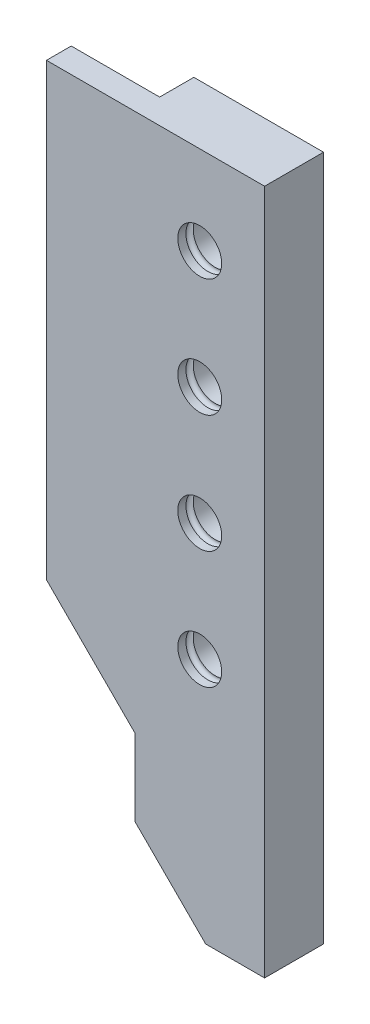
from build123d import *

# Parameters (mm, degrees)
BOSS_EXTRUDE1_DEPTH = 4.2
BOSS_EXTRUDE2_DEPTH = 5.8
CUT_EXTRUDE1_REACH  = 107.801
SKETCH2_R           = 3.725
SKETCH3_R           = 0.65
LPATTERN1_COUNT     = 4
LPATTERN1_PITCH     = 20
CUT_EXTRUDE2_REACH  = 107.801


with BuildPart() as part:
    # Sketch1 → Boss-Extrude1 (new body)
    with BuildSketch(Plane.XY):
        Polygon((25.2, 31.320919527), (25.2, -45), (40.2, -60), (40.2, -85), (62.2, -85), (62.2, 31.320919527), align=None)
    extrude(amount=BOSS_EXTRUDE1_DEPTH)

    # Sketch1<3> → Boss-Extrude2 (add)
    with BuildSketch(Plane.XY):
        Polygon((62.2, 31.320919527), (40.2, 31.320919527), (40.2, -60), (40.2, -85), (62.2, -85), align=None)
    extrude(amount=-BOSS_EXTRUDE2_DEPTH)

    # Sketch2 → Cut-Extrude1 (cut, up to next)
    with BuildSketch(Plane.XY.offset(4.2), mode=Mode.PRIVATE) as cut_extrude1_sk1:
        with Locations((51.2, 16.320919527)):
            Circle(SKETCH2_R)
    cut_extrude1_tool1 = extrude(cut_extrude1_sk1.sketch, amount=-CUT_EXTRUDE1_REACH, mode=Mode.PRIVATE) & part.part
    cut_extrude1 = cut_extrude1_tool1.solids().sort_by_distance((51.2, 16.32092, 4.2))[0]
    add(cut_extrude1, mode=Mode.SUBTRACT)

    # Sketch3 → Cut-Revolve1 (revolve, cut)
    with BuildSketch(Plane.ZY.offset(-51.2)):
        with Locations((-3.8, 20.245919527)):
            Circle(SKETCH3_R)
        with Locations((2.2, 20.245919527)):
            Circle(SKETCH3_R)
    cut_revolve1 = revolve(axis=Axis((51.2, 16.320919527, -5.8), (0, 0, 1)), mode=Mode.SUBTRACT)

    # LPattern1: Cut-Extrude1, Cut-Revolve1 ×4
    with Locations(*[(0, -i * LPATTERN1_PITCH, 0) for i in range(1, LPATTERN1_COUNT)]):
        add(cut_extrude1, mode=Mode.SUBTRACT)
        add(cut_revolve1, mode=Mode.SUBTRACT)

    # Sketch4 → Cut-Extrude2 (cut, up to next)
    with BuildSketch(Plane.XY.offset(4.2), mode=Mode.PRIVATE) as cut_extrude2_sk1:
        Polygon((52.2, -85), (40.2, -73), (40.2, -85), align=None)
    cut_extrude2_tool1 = extrude(cut_extrude2_sk1.sketch, amount=-CUT_EXTRUDE2_REACH, mode=Mode.PRIVATE) & part.part
    add(cut_extrude2_tool1.solids().sort_by_distance((44.2, -81, 4.2))[0], mode=Mode.SUBTRACT)


solid = part.part
